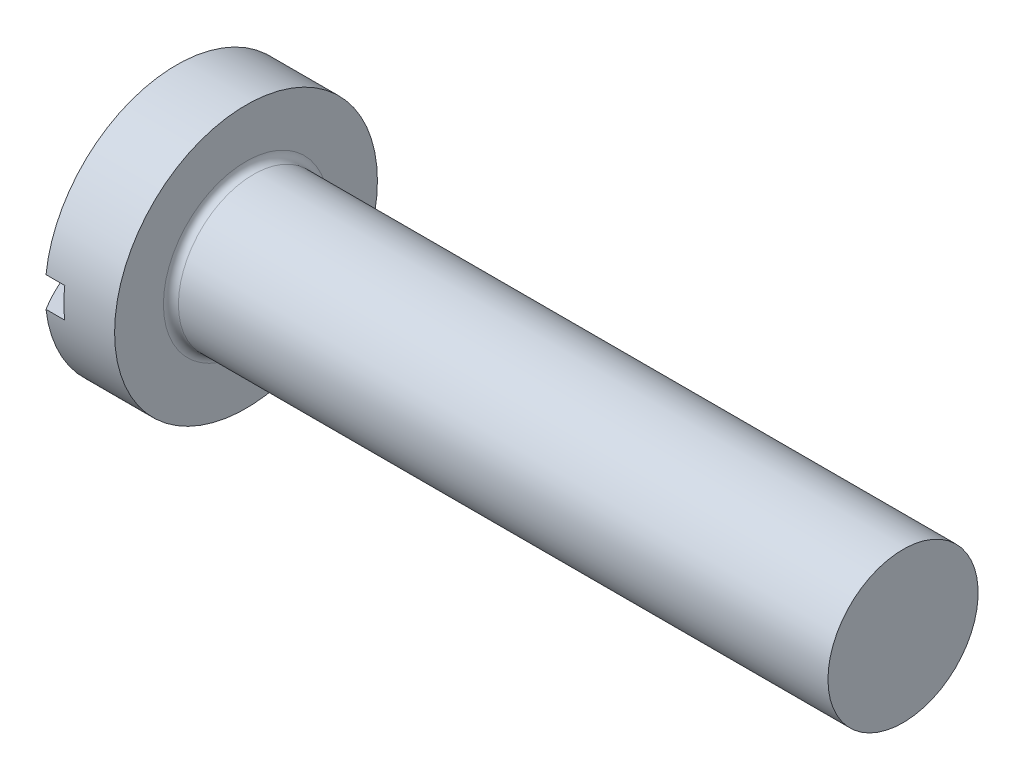
from build123d import *

# Parameters (mm, degrees)
FILLET1_R  = 0.4
SKETCH2_W  = 14
SKETCH2_H  = 1.6
SLOT_DEPTH = 3


with BuildPart() as part:
    # BodySke → Base-Revolve (revolve)
    with BuildSketch(Plane.XY):
        with BuildLine():
            Line((5.7, 4), (5.7, 7))
            Line((5.7, 7), (2, 7))
            ThreePointArc((2, 7), (0.509807694, 3.640054945), (0, 0))
            Line((0, 0), (40.7, 0))
            Line((40.7, 0), (40.7, 4))
            Line((40.7, 4), (5.7, 4))
        make_face()
    revolve(axis=Axis((-25.4, 0, 0), (1, 0, 0)))

    # Fillet1
    fillet1_edges = [part.edges().sort_by_distance(p)[0] for p in [
        (5.7, -4, 0),
    ]]
    fillet(fillet1_edges, radius=FILLET1_R)

    # Sketch2 → Slot (cut)
    with BuildSketch(Plane(origin=(0, 0, 0), x_dir=(0, 0, -1), z_dir=(1, 0, 0))):
        Rectangle(SKETCH2_W, SKETCH2_H)
    extrude(amount=SLOT_DEPTH, mode=Mode.SUBTRACT)


solid = part.part
